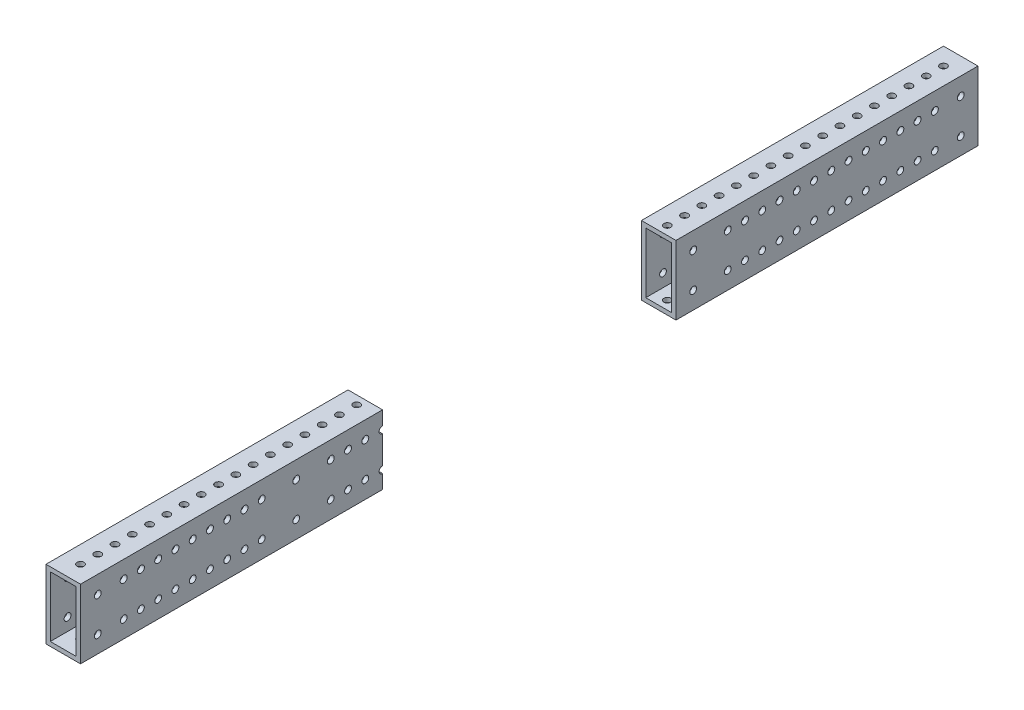
from build123d import *

# Parameters (mm, degrees)
SKETCH1_W           = 25.4
SKETCH1_H           = 50.8
SKETCH1_W_2         = 19.05
SKETCH1_H_2         = 44.45
BOSS_EXTRUDE1_DEPTH = 330.2
SKETCH2_R           = 2.5527
CUT_EXTRUDE1_DEPTH  = 335.32614316
SKETCH4_R           = 2.4892
SKETCH4_R_2         = 2.5527
CUT_EXTRUDE3_DEPTH  = 333.148099498
SKETCH5_W           = 215.9
SKETCH5_H           = 50.8
CUT_EXTRUDE4_DEPTH  = 333.148099498


with BuildPart() as part:
    # Sketch1 → Boss-Extrude1 (new, symmetric)
    with BuildSketch(Plane.XY):
        Rectangle(SKETCH1_W, SKETCH1_H)
        Rectangle(SKETCH1_W_2, SKETCH1_H_2, mode=Mode.SUBTRACT)
    extrude(amount=BOSS_EXTRUDE1_DEPTH, both=True)

    # Sketch2 → Cut-Extrude1 (cut, through all)
    with BuildSketch(Plane(origin=(0, 25.4, 0), x_dir=(1, 0, 0), z_dir=(0, 1, 0))):
        with Locations((0, -317.5)):
            Circle(SKETCH2_R)
        with Locations((0, -304.8)):
            Circle(SKETCH2_R)
        with Locations((0, -292.1)):
            Circle(SKETCH2_R)
        with Locations((0, -279.4)):
            Circle(SKETCH2_R)
        with Locations((0, -266.7)):
            Circle(SKETCH2_R)
        with Locations((0, -254)):
            Circle(SKETCH2_R)
        with Locations((0, -241.3)):
            Circle(SKETCH2_R)
        with Locations((0, -228.6)):
            Circle(SKETCH2_R)
        with Locations((0, -215.9)):
            Circle(SKETCH2_R)
        with Locations((0, -203.2)):
            Circle(SKETCH2_R)
        with Locations((0, -190.5)):
            Circle(SKETCH2_R)
        with Locations((0, -177.8)):
            Circle(SKETCH2_R)
        with Locations((0, -165.1)):
            Circle(SKETCH2_R)
        with Locations((0, -152.4)):
            Circle(SKETCH2_R)
        with Locations((0, -139.7)):
            Circle(SKETCH2_R)
        with Locations((0, -127)):
            Circle(SKETCH2_R)
        with Locations((0, -114.3)):
            Circle(SKETCH2_R)
        with Locations((0, -101.6)):
            Circle(SKETCH2_R)
        with Locations((0, -88.9)):
            Circle(SKETCH2_R)
        with Locations((0, -76.2)):
            Circle(SKETCH2_R)
        with Locations((0, -63.5)):
            Circle(SKETCH2_R)
        with Locations((0, -50.8)):
            Circle(SKETCH2_R)
        with Locations((0, -38.1)):
            Circle(SKETCH2_R)
        with Locations((0, -25.4)):
            Circle(SKETCH2_R)
        with Locations((0, -12.7)):
            Circle(SKETCH2_R)
        Circle(SKETCH2_R)
        with Locations((0, 12.7)):
            Circle(SKETCH2_R)
        with Locations((0, 25.4)):
            Circle(SKETCH2_R)
        with Locations((0, 38.1)):
            Circle(SKETCH2_R)
        with Locations((0, 50.8)):
            Circle(SKETCH2_R)
        with Locations((0, 63.5)):
            Circle(SKETCH2_R)
        with Locations((0, 76.2)):
            Circle(SKETCH2_R)
        with Locations((0, 88.9)):
            Circle(SKETCH2_R)
        with Locations((0, 101.6)):
            Circle(SKETCH2_R)
        with Locations((0, 114.3)):
            Circle(SKETCH2_R)
        with Locations((0, 127)):
            Circle(SKETCH2_R)
        with Locations((0, 139.7)):
            Circle(SKETCH2_R)
        with Locations((0, 152.4)):
            Circle(SKETCH2_R)
        with Locations((0, 165.1)):
            Circle(SKETCH2_R)
        with Locations((0, 177.8)):
            Circle(SKETCH2_R)
        with Locations((0, 190.5)):
            Circle(SKETCH2_R)
        with Locations((0, 203.2)):
            Circle(SKETCH2_R)
        with Locations((0, 215.9)):
            Circle(SKETCH2_R)
        with Locations((0, 228.6)):
            Circle(SKETCH2_R)
        with Locations((0, 241.3)):
            Circle(SKETCH2_R)
        with Locations((0, 254)):
            Circle(SKETCH2_R)
        with Locations((0, 266.7)):
            Circle(SKETCH2_R)
        with Locations((0, 279.4)):
            Circle(SKETCH2_R)
        with Locations((0, 292.1)):
            Circle(SKETCH2_R)
        with Locations((0, 304.8)):
            Circle(SKETCH2_R)
        with Locations((0, 317.5)):
            Circle(SKETCH2_R)
    extrude(amount=-CUT_EXTRUDE1_DEPTH, mode=Mode.SUBTRACT)

    # Sketch4 → Cut-Extrude3 (cut, through all)
    with BuildSketch(Plane(origin=(12.7, 0, 0), x_dir=(0, 0, -1), z_dir=(1, 0, 0))):
        with Locations((-298.45, -12.7)):
            Circle(SKETCH4_R)
        with Locations((-285.75, -12.7)):
            Circle(SKETCH4_R)
        with Locations((-273.05, -12.7)):
            Circle(SKETCH4_R)
        with Locations((120.65, -12.7)):
            Circle(SKETCH4_R)
        with Locations((146.05, -12.7)):
            Circle(SKETCH4_R)
        with Locations((158.75, -12.7)):
            Circle(SKETCH4_R)
        with Locations((171.45, -12.7)):
            Circle(SKETCH4_R)
        with Locations((184.15, -12.7)):
            Circle(SKETCH4_R)
        with Locations((196.85, -12.7)):
            Circle(SKETCH4_R)
        with Locations((209.55, -12.7)):
            Circle(SKETCH4_R)
        with Locations((222.25, -12.7)):
            Circle(SKETCH4_R)
        with Locations((234.95, -12.7)):
            Circle(SKETCH4_R)
        with Locations((247.65, -12.7)):
            Circle(SKETCH4_R)
        with Locations((260.35, -12.7)):
            Circle(SKETCH4_R)
        with Locations((273.05, -12.7)):
            Circle(SKETCH4_R)
        with Locations((-260.35, -12.7)):
            Circle(SKETCH4_R)
        with Locations((-247.65, -12.7)):
            Circle(SKETCH4_R)
        with Locations((-234.95, -12.7)):
            Circle(SKETCH4_R)
        with Locations((-222.25, -12.7)):
            Circle(SKETCH4_R)
        with Locations((-209.55, -12.7)):
            Circle(SKETCH4_R)
        with Locations((-196.85, -12.7)):
            Circle(SKETCH4_R)
        with Locations((-171.45, -12.7)):
            Circle(SKETCH4_R)
        with Locations((-146.05, -12.7)):
            Circle(SKETCH4_R)
        with Locations((-133.35, -12.7)):
            Circle(SKETCH4_R)
        with Locations((-120.65, -12.7)):
            Circle(SKETCH4_R)
        with Locations((-107.95, -12.7)):
            Circle(SKETCH4_R)
        with Locations((-95.25, -12.7)):
            Circle(SKETCH4_R)
        with Locations((-82.55, -12.7)):
            Circle(SKETCH4_R)
        with Locations((-69.85, -12.7)):
            Circle(SKETCH4_R)
        with Locations((-57.15, -12.7)):
            Circle(SKETCH4_R)
        with Locations((-44.45, -12.7)):
            Circle(SKETCH4_R)
        with Locations((-31.75, -12.7)):
            Circle(SKETCH4_R)
        with Locations((-19.05, -12.7)):
            Circle(SKETCH4_R)
        with Locations((-6.35, -12.7)):
            Circle(SKETCH4_R)
        with Locations((6.35, -12.7)):
            Circle(SKETCH4_R)
        with Locations((19.05, -12.7)):
            Circle(SKETCH4_R)
        with Locations((31.75, -12.7)):
            Circle(SKETCH4_R)
        with Locations((44.45, -12.7)):
            Circle(SKETCH4_R)
        with Locations((57.15, -12.7)):
            Circle(SKETCH4_R)
        with Locations((69.85, -12.7)):
            Circle(SKETCH4_R)
        with Locations((82.55, -12.7)):
            Circle(SKETCH4_R)
        with Locations((95.25, -12.7)):
            Circle(SKETCH4_R)
        with Locations((-298.45, 12.7)):
            Circle(SKETCH4_R_2)
        with Locations((-285.75, 12.7)):
            Circle(SKETCH4_R_2)
        with Locations((-273.05, 12.7)):
            Circle(SKETCH4_R_2)
        with Locations((-260.35, 12.7)):
            Circle(SKETCH4_R_2)
        with Locations((-247.65, 12.7)):
            Circle(SKETCH4_R_2)
        with Locations((-234.95, 12.7)):
            Circle(SKETCH4_R_2)
        with Locations((-222.25, 12.7)):
            Circle(SKETCH4_R_2)
        with Locations((-209.55, 12.7)):
            Circle(SKETCH4_R_2)
        with Locations((-196.85, 12.7)):
            Circle(SKETCH4_R_2)
        with Locations((-171.45, 12.7)):
            Circle(SKETCH4_R_2)
        with Locations((-146.05, 12.7)):
            Circle(SKETCH4_R_2)
        with Locations((-133.35, 12.7)):
            Circle(SKETCH4_R_2)
        with Locations((-120.65, 12.7)):
            Circle(SKETCH4_R_2)
        with Locations((-107.95, 12.7)):
            Circle(SKETCH4_R_2)
        with Locations((-95.25, 12.7)):
            Circle(SKETCH4_R_2)
        with Locations((-82.55, 12.7)):
            Circle(SKETCH4_R_2)
        with Locations((-69.85, 12.7)):
            Circle(SKETCH4_R_2)
        with Locations((-57.15, 12.7)):
            Circle(SKETCH4_R_2)
        with Locations((-44.45, 12.7)):
            Circle(SKETCH4_R_2)
        with Locations((-31.75, 12.7)):
            Circle(SKETCH4_R_2)
        with Locations((-19.05, 12.7)):
            Circle(SKETCH4_R_2)
        with Locations((-6.35, 12.7)):
            Circle(SKETCH4_R_2)
        with Locations((6.35, 12.7)):
            Circle(SKETCH4_R_2)
        with Locations((19.05, 12.7)):
            Circle(SKETCH4_R_2)
        with Locations((31.75, 12.7)):
            Circle(SKETCH4_R_2)
        with Locations((44.45, 12.7)):
            Circle(SKETCH4_R_2)
        with Locations((57.15, 12.7)):
            Circle(SKETCH4_R_2)
        with Locations((69.85, 12.7)):
            Circle(SKETCH4_R_2)
        with Locations((82.55, 12.7)):
            Circle(SKETCH4_R_2)
        with Locations((95.25, 12.7)):
            Circle(SKETCH4_R_2)
        with Locations((120.65, 12.7)):
            Circle(SKETCH4_R_2)
        with Locations((146.05, 12.7)):
            Circle(SKETCH4_R_2)
        with Locations((158.75, 12.7)):
            Circle(SKETCH4_R_2)
        with Locations((171.45, 12.7)):
            Circle(SKETCH4_R_2)
        with Locations((184.15, 12.7)):
            Circle(SKETCH4_R_2)
        with Locations((196.85, 12.7)):
            Circle(SKETCH4_R_2)
        with Locations((209.55, 12.7)):
            Circle(SKETCH4_R_2)
        with Locations((222.25, 12.7)):
            Circle(SKETCH4_R_2)
        with Locations((234.95, 12.7)):
            Circle(SKETCH4_R_2)
        with Locations((247.65, 12.7)):
            Circle(SKETCH4_R_2)
        with Locations((260.35, 12.7)):
            Circle(SKETCH4_R_2)
        with Locations((273.05, 12.7)):
            Circle(SKETCH4_R_2)
        with Locations((285.75, 12.7)):
            Circle(SKETCH4_R_2)
        with Locations((285.75, -12.7)):
            Circle(SKETCH4_R)
        with Locations((298.45, 12.7)):
            Circle(SKETCH4_R_2)
        with Locations((298.45, -12.7)):
            Circle(SKETCH4_R)
        with Locations((-317.5, 12.446)):
            Circle(SKETCH4_R_2)
        with Locations((-317.5, -12.954)):
            Circle(SKETCH4_R_2)
        with Locations((317.5, 12.446)):
            Circle(SKETCH4_R_2)
        with Locations((317.5, -12.954)):
            Circle(SKETCH4_R_2)
    extrude(amount=-CUT_EXTRUDE3_DEPTH, mode=Mode.SUBTRACT)

    # Sketch5 → Cut-Extrude4 (cut, through all)
    with BuildSketch(Plane.ZY.offset(12.7)):
        Rectangle(SKETCH5_W, SKETCH5_H)
    extrude(amount=-CUT_EXTRUDE4_DEPTH, mode=Mode.SUBTRACT)


with BuildPart() as cut_extrude4_piece_1:
    # of the separate pieces the step leaves, piece 1, a body of its own (cut_extrude4_pieces)
    add(part.part.solids().sort_by_distance((-12.7, 25.4, 107.95))[0])


with BuildPart() as cut_extrude4_piece_2:
    # of the separate pieces the step leaves, piece 2, a body of its own (cut_extrude4_pieces)
    add(part.part.solids().sort_by_distance((-12.7, 25.4, -330.2))[0])


solid = Compound([cut_extrude4_piece_1.part, cut_extrude4_piece_2.part])
